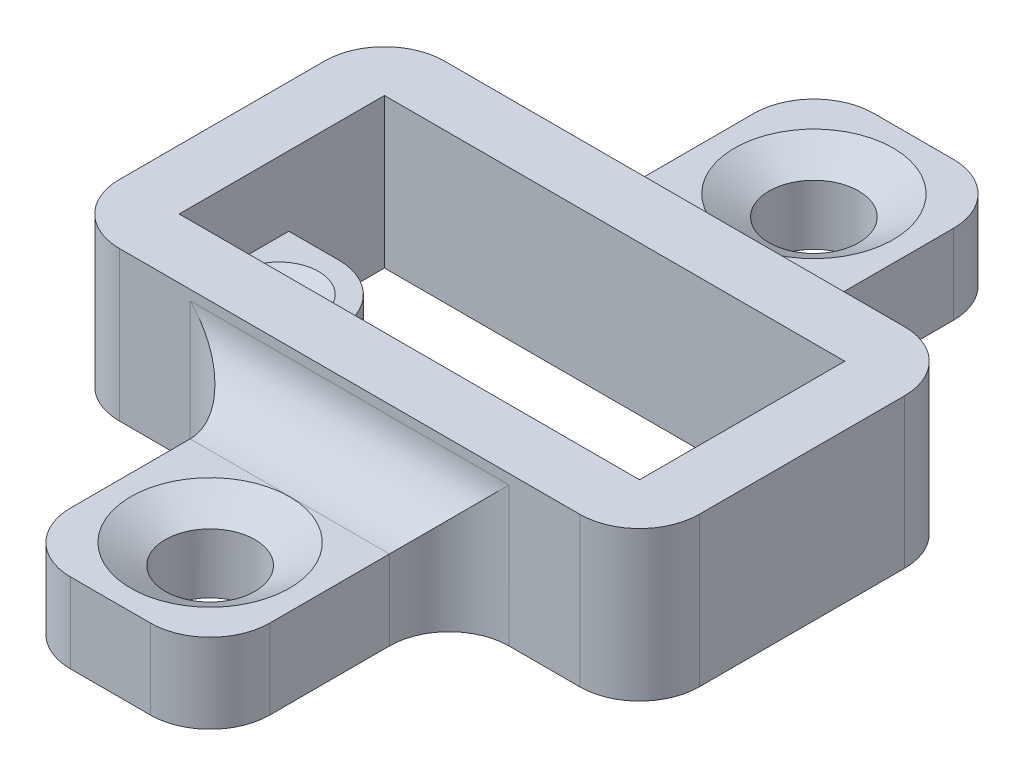
from build123d import *

# Parameters (mm, degrees)
SKETCH5_W             = 29.1
SKETCH5_H             = 16.3
SKETCH5_W_2           = 23.1
SKETCH5_H_2           = 10.3
BOSS_EXTRUDE3_DEPTH   = 7.5
FILLET1_R             = 3
SKETCH7_R             = 1
BOSS_EXTRUDE5_DEPTH   = 4
SKETCH11_W            = 10
SKETCH11_H            = 4
BOSS_EXTRUDE6_DEPTH   = 12
FILLET3_R             = 3
SKETCH13_R            = 2.25
CUT_EXTRUDE1_DEPTH    = 34.593154064
CHAMFER2_SIZE         = 1
CHAMFER2_SIZE2        = 1.732050808
CIRPATTERN1_OUTLINE_R = 2.25
CIRPATTERN1_DEPTH     = 2.9999999
CIRPATTERN1_START     = 2.9999999
CIRPATTERN1_2_DEPTH   = 1.0000001
FILLET5_R             = 3
CHAMFER3_SIZE         = 1
CHAMFER3_SIZE2        = 0.577350269


with BuildPart() as part:
    # Sketch5 → Boss-Extrude3 (new body)
    with BuildSketch(Plane(origin=(0, 0, 0), x_dir=(1, 0, 0), z_dir=(0, 1, 0))):
        with Locations((14.55, 8.15)):
            Rectangle(SKETCH5_W, SKETCH5_H)
        with Locations((14.55, 8.15)):
            Rectangle(SKETCH5_W_2, SKETCH5_H_2, mode=Mode.SUBTRACT)
    extrude(amount=BOSS_EXTRUDE3_DEPTH)

    # Fillet1
    fillet1_edges = [part.edges().sort_by_distance(p)[0] for p in [
        (29.1, 3.75, -16.3),
        (29.1, 3.75, 0),
        (0, 3.75, 0),
        (0, 3.75, -16.3),
    ]]
    fillet(fillet1_edges, radius=FILLET1_R)

    # Sketch7 → Boss-Extrude5 (add)
    with BuildSketch(Plane(origin=(0, 0, 0), x_dir=(1, 0, 0), z_dir=(0, 1, 0))):
        with BuildLine():
            Line((5.5, 8.5), (3, 8.5))
            Line((3, 8.5), (3, 2.5))
            Line((3, 2.5), (5.5, 2.5))
            ThreePointArc((5.5, 2.5), (8.5, 5.5), (5.5, 8.5))
        make_face()
        with Locations(Location((5.5, 5.5, 0), (0, 0, 270))):
            Circle(SKETCH7_R, mode=Mode.SUBTRACT)
    extrude(amount=BOSS_EXTRUDE5_DEPTH)

    # Sketch11 → Boss-Extrude6 (add)
    with BuildSketch(Plane.XY):
        with Locations((14.55, 2)):
            Rectangle(SKETCH11_W, SKETCH11_H)
    extrude(amount=BOSS_EXTRUDE6_DEPTH)

    # Fillet3
    fillet3_edges = [part.edges().sort_by_distance(p)[0] for p in [
        (9.55, 2, 0),
        (19.55, 2, 0),
        (14.55, 4, 0),
        (9.55, 2, 12),
        (19.55, 2, 12),
    ]]
    fillet(fillet3_edges, radius=FILLET3_R)

    # Sketch13 → Cut-Extrude1 (cut, through all)
    with BuildSketch(Plane(origin=(0, 4, 0), x_dir=(1, 0, 0), z_dir=(0, 1, 0))):
        with Locations(Location((14.55, -7, 0), (0, 0, 270))):
            Circle(SKETCH13_R)
    extrude(amount=-CUT_EXTRUDE1_DEPTH, mode=Mode.SUBTRACT)

    # Chamfer2
    chamfer2_edges = [part.edges().sort_by_distance(p)[0] for p in [
        (14.55, 4, 4.75),
    ]]
    chamfer2_side = [part.faces().sort_by_distance(p)[0] for p in [
        (14.55, 2, 4.75),
    ]]
    chamfer(chamfer2_edges, length=CHAMFER2_SIZE, length2=CHAMFER2_SIZE2, reference=chamfer2_side[0])

    # CirPattern1: read off the stored shape, not the designer's step
    # CirPattern1 outline → CirPattern1 (add)
    with BuildSketch(Plane(origin=(0, 0, 0), x_dir=(1, 0, 0), z_dir=(0, 1, 0))):
        with BuildLine():
            Line((9.55, 25.3), (9.55, 16.3))
            Line((9.55, 16.3), (19.55, 16.3))
            Line((19.55, 16.3), (19.55, 25.3))
            ThreePointArc((19.55, 25.3), (18.671320344, 27.421320344), (16.55, 28.3))
            Line((16.55, 28.3), (12.55, 28.3))
            ThreePointArc((12.55, 28.3), (10.428679656, 27.421320344), (9.55, 25.3))
        make_face()
        with Locations((14.55, 23.3)):
            Circle(CIRPATTERN1_OUTLINE_R, mode=Mode.SUBTRACT)
    extrude(amount=CIRPATTERN1_DEPTH)

    # CirPattern1 2 outline → CirPattern1 2 (add)
    with BuildSketch(Plane(origin=(0, 0, 0), x_dir=(1, 0, 0), z_dir=(0, 1, 0)).offset(CIRPATTERN1_START)):
        with BuildLine():
            Line((9.55, 25.3), (9.55, 16.3))
            Line((9.55, 16.3), (19.55, 16.3))
            Line((19.55, 16.3), (19.55, 25.3))
            ThreePointArc((19.55, 25.3), (18.671320344, 27.421320344), (16.55, 28.3))
            Line((16.55, 28.3), (12.55, 28.3))
            ThreePointArc((12.55, 28.3), (10.428679656, 27.421320344), (9.55, 25.3))
        make_face()
    extrude(amount=CIRPATTERN1_2_DEPTH)

    # CirPattern1 3 outline → CirPattern1 3 (revolve, cut)
    with BuildSketch(Plane(origin=(14.55, 0, -23.3), x_dir=(1, 0, 0), z_dir=(0, 0, 1))):
        Polygon((0, 2.9999999), (2.25, 2.9999999), (3.982050808, 4), (0, 4), align=None)
    revolve(axis=Axis((14.55, 0, -23.3), (0, 1, 0)), mode=Mode.SUBTRACT)

    # Fillet5
    fillet5_edges = [part.edges().sort_by_distance(p)[0] for p in [
        (19.55, 2, -16.3),
        (9.55, 2, -16.3),
        (14.55, 4, -16.3),
    ]]
    fillet(fillet5_edges, radius=FILLET5_R)

    # Chamfer3
    chamfer3_edges = [part.edges().sort_by_distance(p)[0] for p in [
        (5.5, 4, -6.5),
    ]]
    chamfer3_side = [part.faces().sort_by_distance(p)[0] for p in [
        (8.297810971, 4, -6.343571748),
    ]]
    chamfer(chamfer3_edges, length=CHAMFER3_SIZE, length2=CHAMFER3_SIZE2, reference=chamfer3_side[0])


solid = part.part
